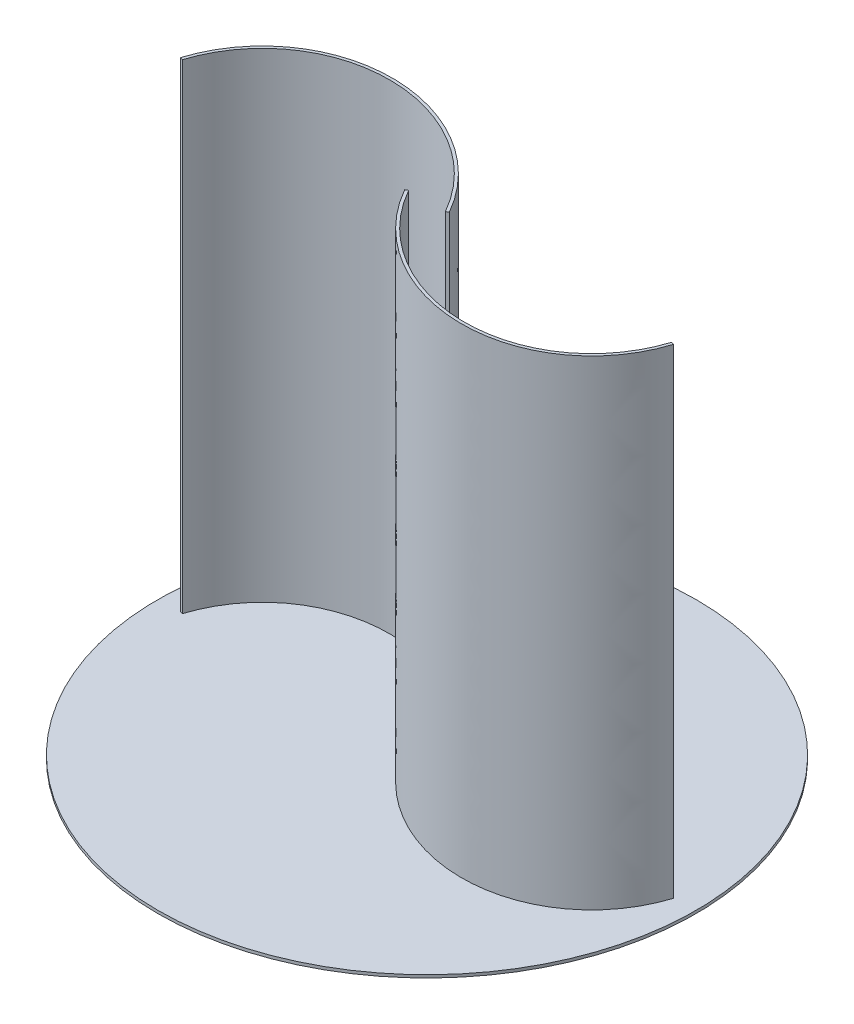
from build123d import *

# Parameters (mm, degrees)
EXTRUIR_L_MINA1_DEPTH      = 500
CROQUIS2_R                 = 280.5
SALIENTE_EXTRUIR8_DEPTH    = 3
S_LIDO_MOVER_COPIAR1_ANGLE = 90
S_LIDO_MOVER_COPIAR4_ANGLE = 30
S_LIDO_MOVER_COPIAR5_ANGLE = 60


# Read off the part's stored shape, not the designer's step: Extruir-Lámina1
with BuildPart() as part:
    # Extruir-Lámina1 outline → Extruir-Lámina1 (new body)
    with BuildSketch(Plane(origin=(0, 0, 0), x_dir=(1, 0, 0), z_dir=(0, 1, 0))):
        with BuildLine():
            Line((19.125, 0), (21.74073175, 1.468995374))
            add(Edge.make_bspline(
                [(21.74073175, 1.468995374), (17.946731989, 8.224691008), (13.69560143, 14.762783798), (4.367017147, 27.269837443), (-0.71037321, 33.238715513), (-11.586873507, 44.484783529), (-17.3859105, 49.761898252), (-29.586590101, 59.515807861), (-35.988151721, 63.992536753), (-49.262571773, 72.053091806), (-56.135343096, 75.636862301), (-70.211208073, 81.836795033), (-77.414210442, 84.452912303), (-92.002580634, 88.662220627), (-99.387854473, 90.255377069), (-114.188612377, 92.384025129), (-121.604000183, 92.919491806), (-136.311486484, 92.919491806), (-143.603485457, 92.384009771), (-157.912281808, 90.25091942), (-164.928974484, 88.653307228), (-178.539889063, 84.427137922), (-185.13400018, 81.798593281), (-197.760357085, 75.564007629), (-203.792489054, 71.958002232), (-215.166754121, 63.843516173), (-220.508778973, 59.335099151), (-230.38932678, 49.510909009), (-234.927758788, 44.195226033), (-243.105282037, 32.869400738), (-246.744308638, 26.85936626), (-253.047209415, 14.272502845), (-255.711047051, 7.695787707), (-257.860174862, 0.905207025)],
                knots=[0, 0, 0, 0, 0.0625, 0.0625, 0.125, 0.125, 0.1875, 0.1875, 0.25, 0.25, 0.3125, 0.3125, 0.375, 0.375, 0.4375, 0.4375, 0.5, 0.5, 0.5625, 0.5625, 0.625, 0.625, 0.6875, 0.6875, 0.75, 0.75, 0.8125, 0.8125, 0.875, 0.875, 0.9375, 0.9375, 1, 1, 1, 1], degree=3))
            Line((-257.860174862, 0.905207025), (-255, 0))
            add(Edge.make_bspline(
                [(19.125, 0), (-156.197816113, 312.184411633), (-255, 0)],
                knots=[1.263328629, 1.263328629, 1.263328629, 3.571926027, 3.571926027, 3.571926027], degree=2, weights=[1, 0.404559981, 1]))
        make_face()
        with BuildLine():
            Line((-19.125, 0), (-21.74073175, -1.468995374))
            add(Edge.make_bspline(
                [(-21.74073175, -1.468995374), (-17.946731989, -8.224691008), (-13.69560143, -14.762783798), (-4.367017147, -27.269837443), (0.71037321, -33.238715513), (11.586873507, -44.484783529), (17.3859105, -49.761898252), (29.586590101, -59.515807861), (35.988151721, -63.992536753), (49.262571773, -72.053091806), (56.135343096, -75.636862301), (70.211208073, -81.836795033), (77.414210442, -84.452912303), (92.002580634, -88.662220627), (99.387854473, -90.255377069), (114.188612377, -92.384025129), (121.604000183, -92.919491806), (136.311486484, -92.919491806), (143.603485457, -92.384009771), (157.912281808, -90.25091942), (164.928974484, -88.653307228), (178.539889063, -84.427137922), (185.13400018, -81.798593281), (197.760357085, -75.564007629), (203.792489054, -71.958002232), (215.166754121, -63.843516173), (220.508778973, -59.335099151), (230.38932678, -49.510909009), (234.927758788, -44.195226033), (243.105282037, -32.869400738), (246.744308638, -26.85936626), (253.047209415, -14.272502845), (255.711047051, -7.695787707), (257.860174862, -0.905207025)],
                knots=[0, 0, 0, 0, 0.0625, 0.0625, 0.125, 0.125, 0.1875, 0.1875, 0.25, 0.25, 0.3125, 0.3125, 0.375, 0.375, 0.4375, 0.4375, 0.5, 0.5, 0.5625, 0.5625, 0.625, 0.625, 0.6875, 0.6875, 0.75, 0.75, 0.8125, 0.8125, 0.875, 0.875, 0.9375, 0.9375, 1, 1, 1, 1], degree=3))
            Line((257.860174862, -0.905207025), (255, 0))
            add(Edge.make_bspline(
                [(-19.125, 0), (156.197816113, -312.184411633), (255, 0)],
                knots=[1.263328629, 1.263328629, 1.263328629, 3.571926027, 3.571926027, 3.571926027], degree=2, weights=[1, 0.404559981, 1]))
        make_face()
    extrude(amount=EXTRUIR_L_MINA1_DEPTH)

    # Croquis2 → Saliente-Extruir8 (add)
    with BuildSketch(Plane.XZ):
        with Locations(Location((0, 0, 0), (0, 0, 270))):
            Circle(CROQUIS2_R)
    extrude(amount=SALIENTE_EXTRUIR8_DEPTH)


with BuildPart() as part_1:
    # Sólido-Mover/Copiar1: moved
    add(part.part.rotate(Axis((0, 0, 0), (0, -1, 0)), S_LIDO_MOVER_COPIAR1_ANGLE))


with BuildPart() as part_2:
    # Sólido-Mover/Copiar4: moved
    add(part_1.part.rotate(Axis((0, 0, 0), (0, 1, 0)), S_LIDO_MOVER_COPIAR4_ANGLE))


with BuildPart() as part_3:
    # Sólido-Mover/Copiar5: moved
    add(part_2.part.rotate(Axis((0, 0, 0), (0, 1, 0)), S_LIDO_MOVER_COPIAR5_ANGLE))


solid = part_3.part
